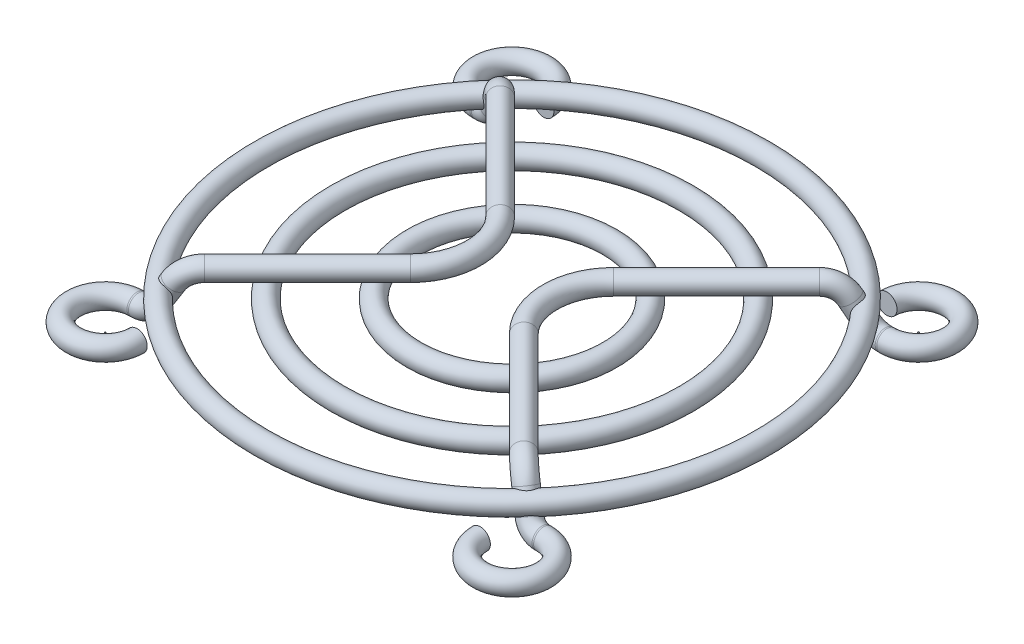
from build123d import *

# Parameters (mm, degrees)
SKETCH_2_R                = 0.8
SWEEP_2_OUTLINE_R         = 0.8
SWEEP_2_ANGLE             = 270
SWEEP_2_2_OUTLINE_R       = 0.8
SWEEP_2_2_ANGLE           = 64.201526
SWEEP_2_3_OUTLINE_R       = 0.8
SWEEP_2_3_ANGLE           = 59.495369
SWEEP_2_4_OUTLINE_R       = 0.8
SWEEP_2_4_ANGLE           = 90
SWEEP_2_5_OUTLINE_R       = 0.8
SWEEP_2_5_ANGLE           = 59.495369
SWEEP_2_6_OUTLINE_R       = 0.8
SWEEP_2_6_ANGLE           = 64.201526
SWEEP_2_7_OUTLINE_R       = 0.8
SWEEP_2_7_ANGLE           = 270
SWEEP_START               = -16.0000001
SWEEP_2_8_OUTLINE_R       = 0.8
SWEEP_2_8_DEPTH           = 0.121755873
SWEEP_START_2             = -10.833453621
SWEEP_2_9_OUTLINE_R       = 0.8
SWEEP_2_9_DEPTH           = 1.722294661
SWEEP_START_3             = -17.109312799
SWEEP_2_10_OUTLINE_R      = 0.8
SWEEP_2_10_DEPTH          = 11.45245865
SWEEP_2_11_OUTLINE_R      = 0.8
SWEEP_2_11_DEPTH          = 11.45245865
SWEEP_2_12_OUTLINE_R      = 0.8
SWEEP_2_12_DEPTH          = 1.722294661
SWEEP_2_13_OUTLINE_R      = 0.8
SWEEP_2_13_DEPTH          = 0.121755873
CROQUIS1_R                = 0.049260452
SALIENTE_EXTRUIR1_DEPTH   = 0.1
CROQUIS1_R_2              = 0.052882522
SALIENTE_EXTRUIR1_2_DEPTH = 0.1


with BuildPart() as part:
    # По траектории1: sweep along a path in Эскиз1
    with BuildLine(Plane(origin=(0, 0, 0), x_dir=(1, 0, 0), z_dir=(0, 1, 0))) as sweep_1_path:
        CenterArc((0, 0), 19.7, 0, 360)
    # Эскиз2 → По траектории1 (sweep)
    with BuildSketch(Plane.XY):
        with Locations((19.7, 0)):
            Circle(SKETCH_2_R)
        with Locations((13.7, 0)):
            Circle(SKETCH_2_R)
        with Locations((7.7, 0)):
            Circle(SKETCH_2_R)
    sweep(path=sweep_1_path.line)


with BuildPart() as body_2:
    # По траектории2: read off the stored shape, not the designer's step
    # По траектории2 outline → По траектории2 (revolve)
    with BuildSketch(Plane(origin=(-16, 0, -16), x_dir=(1, 0, 0), z_dir=(0, 0, 1))):
        with Locations((2.5, -1.6)):
            Circle(SWEEP_2_OUTLINE_R)
    revolve(axis=Axis((-16, 0, -16), (0, 1, 0)), revolution_arc=SWEEP_2_ANGLE)

    # Sweep 2 2 outline → Sweep 2 2 (revolve)
    with BuildSketch(Plane(origin=(-15.878244327, -4.137117935, -1.368017212), x_dir=(0.9003303642061121, -0.413202791127157, -0.13663340987187794), z_dir=(0.43520711769051934, 0.8548091340984048, 0.28265899768704694))):
        with Locations((1.4, 12.315111602)):
            Circle(SWEEP_2_2_OUTLINE_R)
    revolve(axis=Axis((-15.878244327, -4.137117935, -1.368017212), (0, 0.31395031082428093, -0.9494394147776558)), revolution_arc=SWEEP_2_2_ANGLE)

    # Sweep 2 3 outline → Sweep 2 3 (revolve)
    with BuildSketch(Plane(origin=(-12.141916519, -0.490931402, -12.054305543), x_dir=(-0.5642976565367124, 0.5036141214653465, -0.6541719739394692), z_dir=(-0.43520711769049536, -0.8548091340984181, -0.28265899768704283))):
        with Locations((2, -0.852000479)):
            Circle(SWEEP_2_3_OUTLINE_R)
    revolve(axis=Axis((-12.141916519, -0.490931402, -12.054305543), (0.7015432413890861, -0.125196489258284, -0.7015432413890781)), revolution_arc=SWEEP_2_3_ANGLE)

    # Sweep 2 4 outline → Sweep 2 4 (revolve)
    with BuildSketch(Plane(origin=(-8, 0, 0), x_dir=(0.7071067811865457, 0, 0.7071067811865493), z_dir=(-0.7071067811865493, 0, 0.7071067811865457))):
        with Locations((5.000000002, 1.6)):
            Circle(SWEEP_2_4_OUTLINE_R)
    revolve(axis=Axis((-8, 0, 0), (0, 1, 0)), revolution_arc=SWEEP_2_4_ANGLE)

    # Sweep 2 5 outline → Sweep 2 5 (revolve)
    with BuildSketch(Plane(origin=(-12.141916519, -0.490931402, 12.054305543), x_dir=(0.0885272865352575, 0.99213196656363, 0.08852728653522032), z_dir=(0.7071067811865515, -2.713801405818117e-14, -0.7071067811865441))):
        with Locations((2, -0.852000479)):
            Circle(SWEEP_2_5_OUTLINE_R)
    revolve(axis=Axis((-12.141916519, -0.490931402, 12.054305543), (0.701543241389082, -0.12519648925822402, 0.7015432413890942)), revolution_arc=SWEEP_2_5_ANGLE)

    # Sweep 2 6 outline → Sweep 2 6 (revolve)
    with BuildSketch(Plane(origin=(-15.878244327, -4.137117935, 1.368017212), x_dir=(1.3934999695075554e-15, -0.9494394147776508, 0.3139503108242959), z_dir=(-1, 0, 0))):
        with Locations((1.4, 12.315111602)):
            Circle(SWEEP_2_6_OUTLINE_R)
    revolve(axis=Axis((-15.878244327, -4.137117935, 1.368017212), (0, 0.3139503108242959, 0.9494394147776508)), revolution_arc=SWEEP_2_6_ANGLE)

    # Sweep 2 7 outline → Sweep 2 7 (revolve)
    with BuildSketch(Plane(origin=(-16, 0, 16), x_dir=(0, 0, -1), z_dir=(1, 0, 0))):
        with Locations((2.5, -1.6)):
            Circle(SWEEP_2_7_OUTLINE_R)
    revolve(axis=Axis((-16, 0, 16), (0, 1, 0)), revolution_arc=SWEEP_2_7_ANGLE)

    # Sweep 2 8 outline → Sweep 2 8 (add)
    with BuildSketch(Plane.YZ.offset(SWEEP_START)):
        with Locations((-1.6, -13.5)):
            Circle(SWEEP_2_8_OUTLINE_R)
    extrude(amount=SWEEP_2_8_DEPTH)

    # Sweep 2 9 outline → Sweep 2 9 (add)
    with BuildSketch(Plane(origin=(0, 0, 0), x_dir=(0.90033036420612, -0.4132027911271415, -0.1366334098718725), z_dir=(0.43520711769050285, 0.8548091340984126, 0.2826589976870489)).offset(SWEEP_START_2)):
        with Locations((-10.999279964, 12.315111602)):
            Circle(SWEEP_2_9_OUTLINE_R)
    extrude(amount=SWEEP_2_9_DEPTH)

    # Sweep 2 10 outline → Sweep 2 10 (add)
    with BuildSketch(Plane(origin=(0, 0, 0), x_dir=(0.7071067811865509, 0, -0.707106781186544), z_dir=(0.707106781186544, 0, 0.707106781186551)).offset(SWEEP_START_3)):
        with Locations((-0.656854248, 1.6)):
            Circle(SWEEP_2_10_OUTLINE_R)
    extrude(amount=SWEEP_2_10_DEPTH)

    # Sweep 2 11 outline → Sweep 2 11 (add)
    with BuildSketch(Plane(origin=(0, 0, 0), x_dir=(0.707106781186541, 0, 0.707106781186554), z_dir=(0.707106781186554, 0, -0.707106781186541)).offset(SWEEP_START_3)):
        with Locations((-0.656854248, -1.6)):
            Circle(SWEEP_2_11_OUTLINE_R)
    extrude(amount=SWEEP_2_11_DEPTH)

    # Sweep 2 12 outline → Sweep 2 12 (add)
    with BuildSketch(Plane(origin=(0, 0, 0), x_dir=(0.9003303642061413, -0.41320279112709724, 0.1366334098718661), z_dir=(0.43520711769045883, 0.8548091340984276, -0.28265899768707087)).offset(SWEEP_START_2)):
        with Locations((-10.999279964, -12.315111602)):
            Circle(SWEEP_2_12_OUTLINE_R)
    extrude(amount=SWEEP_2_12_DEPTH)

    # Sweep 2 13 outline → Sweep 2 13 (add)
    with BuildSketch(Plane.YZ.offset(SWEEP_START)):
        with Locations((-1.6, 13.5)):
            Circle(SWEEP_2_13_OUTLINE_R)
    extrude(amount=SWEEP_2_13_DEPTH)


with BuildPart() as body_3:
    # Зеркальное отражение1: mirrored copy
    add(body_2.part.mirror(Plane(origin=(0, 0, 0), x_dir=(0, 0, 1), z_dir=(1, 0, 0))))


with BuildPart() as body_4:
    # Croquis1 → Saliente-Extruir1 (new body)
    with BuildSketch(Plane(origin=(0, -2.4, 0), x_dir=(1, 0, 0), z_dir=(0, 1, 0))):
        with Locations(Location((-16, -16, 0), (0, 0, 270))):
            Circle(CROQUIS1_R)
    extrude(amount=SALIENTE_EXTRUIR1_DEPTH)


with BuildPart() as body_5:
    # Croquis1 → Saliente-Extruir1 2 (new body)
    with BuildSketch(Plane(origin=(0, -2.4, 0), x_dir=(1, 0, 0), z_dir=(0, 1, 0))):
        with Locations(Location((16, 16, 0), (0, 0, 270))):
            Circle(CROQUIS1_R_2)
    extrude(amount=SALIENTE_EXTRUIR1_2_DEPTH)


solid = Compound([part.part, body_2.part, body_3.part, body_4.part, body_5.part])
